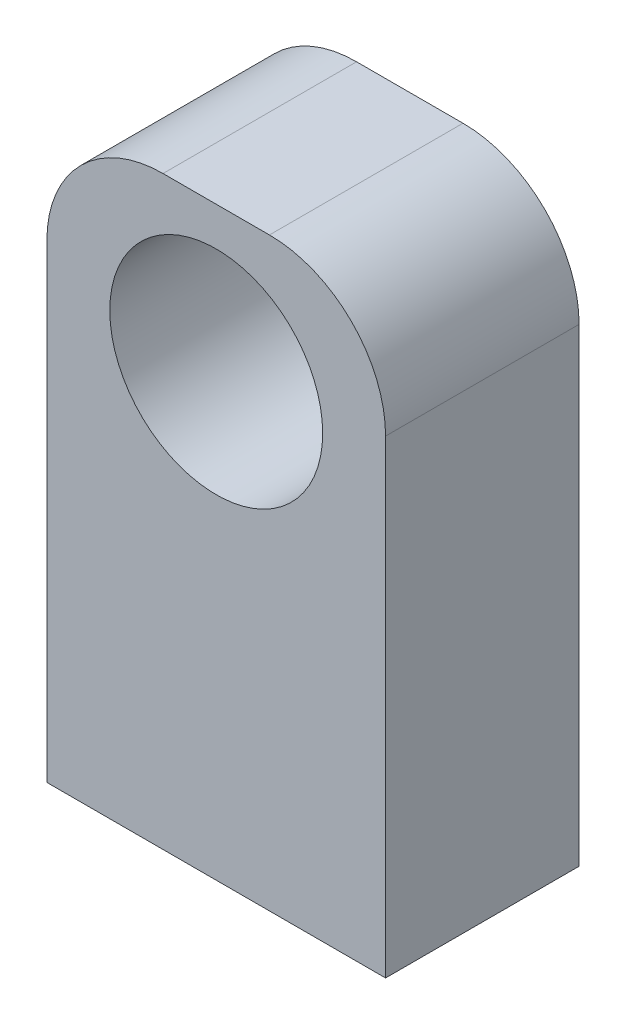
from build123d import *

# Parameters (mm, degrees)
SKETCH1_W           = 35
SKETCH1_H           = 20
BOSS_EXTRUDE1_DEPTH = 60.5
SKETCH2_R           = 11
CUT_EXTRUDE1_DEPTH  = 67.397440648
SKETCH3_R           = 1.75
CUT_EXTRUDE2_DEPTH  = 10
FILLET1_R           = 12


with BuildPart() as part:
    # Sketch1 → Boss-Extrude1 (new body)
    with BuildSketch(Plane(origin=(0, 0, 0), x_dir=(1, 0, 0), z_dir=(0, 1, 0))):
        with Locations((1.164675851, -0.855170824)):
            Rectangle(SKETCH1_W, SKETCH1_H)
    extrude(amount=BOSS_EXTRUDE1_DEPTH)

    # Sketch2 → Cut-Extrude1 (cut, through all)
    with BuildSketch(Plane.XY.offset(10.855170824)):
        with Locations((1.164675851, 45.5)):
            Circle(SKETCH2_R)
    extrude(amount=-CUT_EXTRUDE1_DEPTH, mode=Mode.SUBTRACT)

    # Sketch3 → Cut-Extrude2 (cut)
    with BuildSketch(Plane.XZ):
        with Locations((-8.335324149, 0.855170824)):
            Circle(SKETCH3_R)
        with Locations((10.664675851, 0.855170824)):
            Circle(SKETCH3_R)
    extrude(amount=-CUT_EXTRUDE2_DEPTH, mode=Mode.SUBTRACT)

    # Fillet1
    fillet1_edges = [part.edges().sort_by_distance(p)[0] for p in [
        (18.664675851, 60.5, 0.855170824),
        (-16.335324149, 60.5, 0.855170824),
    ]]
    fillet(fillet1_edges, radius=FILLET1_R)


solid = part.part
